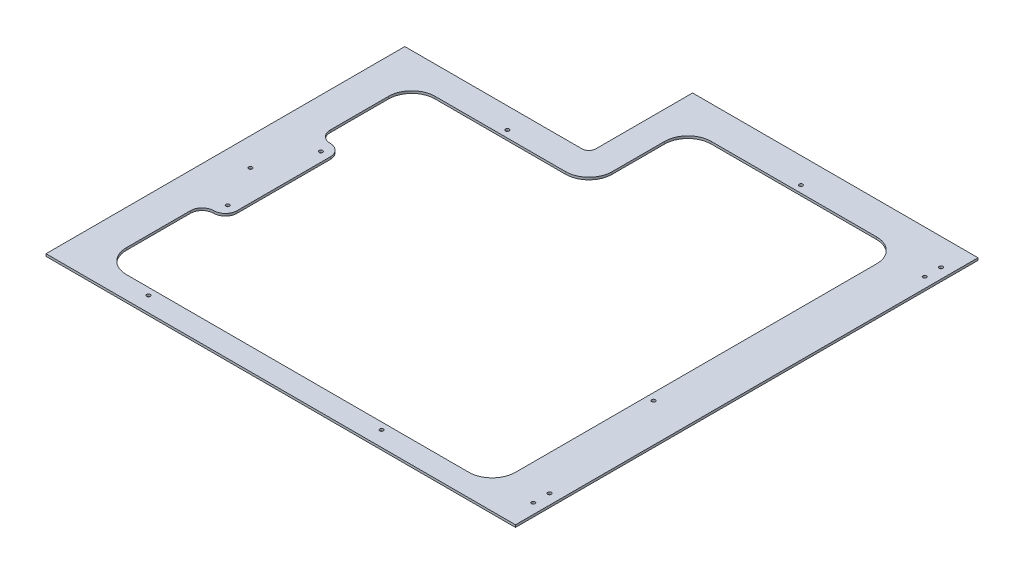
from build123d import *

# Parameters (mm, degrees)
CROQUIS1_W              = 404
CROQUIS1_H              = 400
SALIENTE_EXTRUIR1_DEPTH = 2
CROQUIS3_W              = 157
CROQUIS3_H              = 90
CORTAR_EXTRUIR2_DEPTH   = 2
REDONDEO1_R             = 5
CORTAR_EXTRUIR3_DEPTH   = 2
REDONDEO2_R             = 20
CROQUIS6_R              = 1.55
CORTAR_EXTRUIR5_DEPTH   = 2
CROQUIS7_R              = 1.55
CORTAR_EXTRUIR6_DEPTH   = 2
CROQUIS8_W              = 20
CROQUIS8_H              = 100
SALIENTE_EXTRUIR2_DEPTH = 2
REDONDEO3_R             = 10
CROQUIS9_R              = 1.55
CORTAR_EXTRUIR7_DEPTH   = 2
CROQUIS10_OUTSIDE_W     = 519.704
CROQUIS10_OUTSIDE_H     = 515.704
CORTAR_EXTRUIR8_DEPTH   = 10
CROQUIS11_W             = 245
CROQUIS11_H             = 1
CORTAR_EXTRUIR9_DEPTH   = 2
CROQUIS12_W             = 1
CROQUIS12_H             = 308
SALIENTE_EXTRUIR3_DEPTH = 2


with BuildPart() as part:
    # Croquis1 → Saliente-Extruir1 (new body)
    with BuildSketch(Plane(origin=(0, 0, 0), x_dir=(1, 0, 0), z_dir=(0, 1, 0))):
        with Locations((202, 200)):
            Rectangle(CROQUIS1_W, CROQUIS1_H)
    extrude(amount=SALIENTE_EXTRUIR1_DEPTH)

    # Croquis3 → Cortar-Extruir2 (cut)
    with BuildSketch(Plane.XZ):
        with Locations((78.5, -355)):
            Rectangle(CROQUIS3_W, CROQUIS3_H)
    extrude(amount=-CORTAR_EXTRUIR2_DEPTH, mode=Mode.SUBTRACT)

    # Redondeo1
    redondeo1_edges = [part.edges().sort_by_distance(p)[0] for p in [
        (157, 1, -310),
    ]]
    fillet(redondeo1_edges, radius=REDONDEO1_R)

    # Croquis4 → Cortar-Extruir3 (cut)
    with BuildSketch(Plane.XZ):
        Polygon((30, -20), (364, -20), (364, -233.661541009), (364, -370), (182, -370), (182, -285), (30, -285), align=None)
    extrude(amount=-CORTAR_EXTRUIR3_DEPTH, mode=Mode.SUBTRACT)

    # Redondeo2
    redondeo2_edges = [part.edges().sort_by_distance(p)[0] for p in [
        (30, 1, -285),
        (30, 1, -20),
        (364, 1, -20),
        (364, 1, -370),
        (182, 1, -370),
        (182, 1, -285),
    ]]
    fillet(redondeo2_edges, radius=REDONDEO2_R)

    # Croquis6 → Cortar-Extruir5 (cut)
    with BuildSketch(Plane.XZ):
        with Locations(Location((75, -14, 0), (0, 0, 270))):
            Circle(CROQUIS6_R)
        with Locations(Location((275, -14, 0), (0, 0, 270))):
            Circle(CROQUIS6_R)
        with Locations(Location((273, -376, 0), (0, 0, 270))):
            Circle(CROQUIS6_R)
        with Locations(Location((106, -291, 0), (0, 0, 270))):
            Circle(CROQUIS6_R)
        with Locations(Location((24, -152.5, 0), (0, 0, 270))):
            Circle(CROQUIS6_R)
        with Locations(Location((370, -152.5, 0), (0, 0, 270))):
            Circle(CROQUIS6_R)
    extrude(amount=-CORTAR_EXTRUIR5_DEPTH, mode=Mode.SUBTRACT)

    # Croquis7 → Cortar-Extruir6 (cut)
    with BuildSketch(Plane.XZ):
        with Locations(Location((394.25, -25, 0), (0, 0, 270))):
            Circle(CROQUIS7_R)
        with Locations(Location((394.25, -39, 0), (0, 0, 270))):
            Circle(CROQUIS7_R)
        with Locations(Location((394.25, -375, 0), (0, 0, 270))):
            Circle(CROQUIS7_R)
        with Locations(Location((394.25, -361, 0), (0, 0, 270))):
            Circle(CROQUIS7_R)
    extrude(amount=-CORTAR_EXTRUIR6_DEPTH, mode=Mode.SUBTRACT)

    # Croquis8 → Saliente-Extruir2 (add)
    with BuildSketch(Plane.XZ):
        with Locations((40, -155)):
            Rectangle(CROQUIS8_W, CROQUIS8_H)
    extrude(amount=-SALIENTE_EXTRUIR2_DEPTH)

    # Redondeo3
    redondeo3_edges = [part.edges().sort_by_distance(p)[0] for p in [
        (30, 1, -205),
        (30, 1, -105),
    ]]
    fillet(redondeo3_edges, radius=REDONDEO3_R)
    redondeo3_2_edges = [part.edges().sort_by_distance(p)[0] for p in [
        (50, 1, -205),
        (50, 1, -105),
    ]]
    fillet(redondeo3_2_edges, radius=REDONDEO3_R - 0.0001)  # a hair under: the kernel refuses the full size

    # Croquis9 → Cortar-Extruir7 (cut)
    with BuildSketch(Plane.XZ):
        with Locations(Location((42, -115, 0), (0, 0, 270))):
            Circle(CROQUIS9_R)
        with Locations(Location((42, -195, 0), (0, 0, 270))):
            Circle(CROQUIS9_R)
    extrude(amount=-CORTAR_EXTRUIR7_DEPTH, mode=Mode.SUBTRACT)

    # Croquis10 outside → Cortar-Extruir8 (cut)
    with BuildSketch(Plane.XZ):
        with Locations((202, -200)):
            Rectangle(CROQUIS10_OUTSIDE_W, CROQUIS10_OUTSIDE_H)
        with BuildLine():
            Line((1, -309), (152, -309))
            ThreePointArc((152, -309), (156.242640687, -310.757359313), (158, -315))
            Line((158, -315), (158, -399))
            Line((158, -399), (403, -399))
            Line((403, -399), (403, -1))
            Line((403, -1), (1, -1))
            Line((1, -1), (1, -309))
        make_face(mode=Mode.SUBTRACT)
    extrude(amount=-CORTAR_EXTRUIR8_DEPTH, mode=Mode.SUBTRACT)

    # Croquis11 → Cortar-Extruir9 (cut)
    with BuildSketch(Plane.XZ):
        with Locations((280.5, -398.5)):
            Rectangle(CROQUIS11_W, CROQUIS11_H)
    extrude(amount=-CORTAR_EXTRUIR9_DEPTH, mode=Mode.SUBTRACT)

    # Croquis12 → Saliente-Extruir3 (add)
    with BuildSketch(Plane.XZ):
        with Locations((0.5, -155)):
            Rectangle(CROQUIS12_W, CROQUIS12_H)
    extrude(amount=-SALIENTE_EXTRUIR3_DEPTH)


solid = part.part
